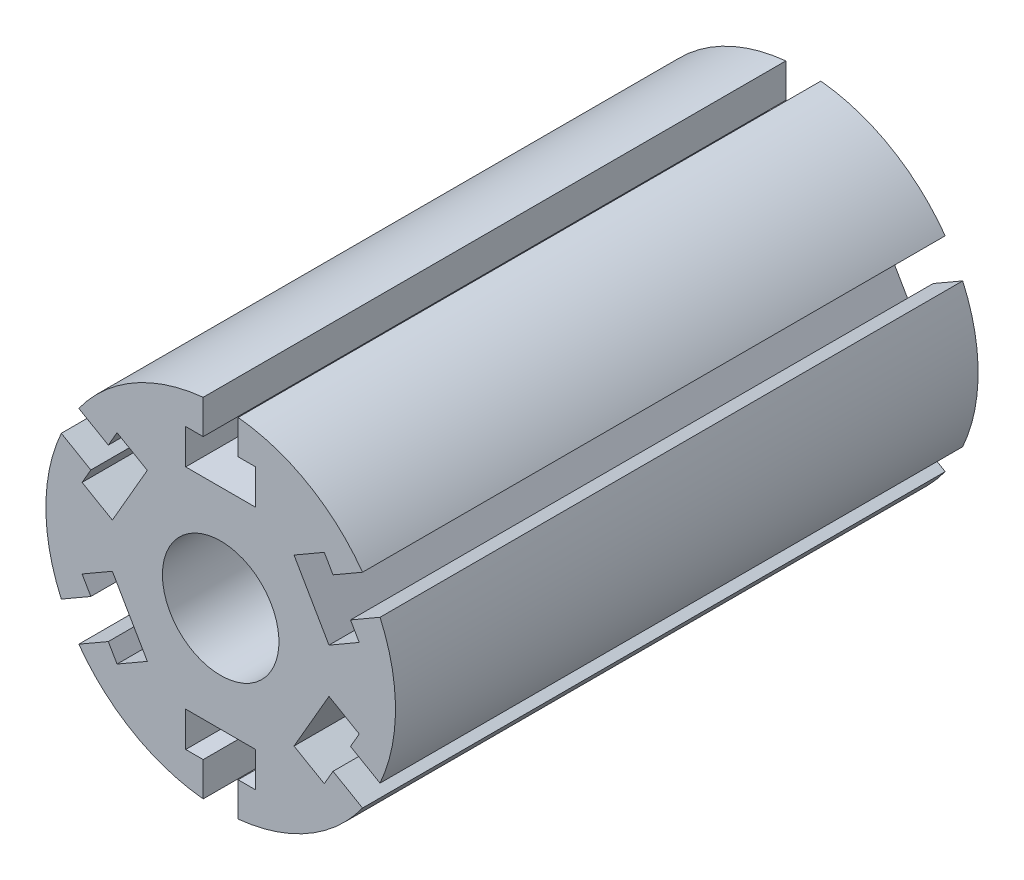
from build123d import *

# Parameters (mm, degrees)
ESBO_O1_R                = 7.5
RESSALTO_EXTRUS_O1_DEPTH = 12.5
ESBO_O7_R                = 2.5
CORTE_EXTRUS_O1_DEPTH    = 16
CORTE_EXTRUS_O2_DEPTH    = 28.156951228


with BuildPart() as part:
    # Esboço1 → Ressalto-extrusão1 (new, symmetric)
    with BuildSketch(Plane.XY):
        Circle(ESBO_O1_R)
    extrude(amount=RESSALTO_EXTRUS_O1_DEPTH, both=True)

    # Esboço7 → Corte-extrusão1 (cut)
    with BuildSketch(Plane(origin=(0, 0, 12.5), x_dir=(-1, 0, 0), z_dir=(0, 0, -1))):
        Circle(ESBO_O7_R)
    extrude(amount=CORTE_EXTRUS_O1_DEPTH, mode=Mode.SUBTRACT)

    # Esboço9 → Corte-extrusão2 (cut, through all)
    with BuildSketch(Plane.XY.offset(12.5)):
        Polygon((-0.75, 6), (-0.75, 7.5), (0.75, 7.5), (0.75, 6), (1.5, 6), (1.5, 4.5), (-1.5, 4.5), (-1.5, 6), align=None)
        Polygon((4.446152423, 4.299038106), (3.147114317, 3.549038106), (4.647114317, 0.950961894), (5.946152423, 1.700961894), (5.571152423, 2.350480947), (6.870190528, 3.100480947), (6.120190528, 4.399519053), (4.821152423, 3.649519053), align=None)
        Polygon((5.946152423, -1.700961894), (4.647114317, -0.950961894), (3.147114317, -3.549038106), (4.446152423, -4.299038106), (4.821152423, -3.649519053), (6.120190528, -4.399519053), (6.870190528, -3.100480947), (5.571152423, -2.350480947), align=None)
        Polygon((1.5, -6), (1.5, -4.5), (-1.5, -4.5), (-1.5, -6), (-0.75, -6), (-0.75, -7.5), (0.75, -7.5), (0.75, -6), align=None)
        Polygon((-4.446152423, -4.299038106), (-3.147114317, -3.549038106), (-4.647114317, -0.950961894), (-5.946152423, -1.700961894), (-5.571152423, -2.350480947), (-6.870190528, -3.100480947), (-6.120190528, -4.399519053), (-4.821152423, -3.649519053), align=None)
        Polygon((-5.946152423, 1.700961894), (-4.647114317, 0.950961894), (-3.147114317, 3.549038106), (-4.446152423, 4.299038106), (-4.821152423, 3.649519053), (-6.120190528, 4.399519053), (-6.870190528, 3.100480947), (-5.571152423, 2.350480947), align=None)
    extrude(amount=-CORTE_EXTRUS_O2_DEPTH, mode=Mode.SUBTRACT)


solid = part.part
